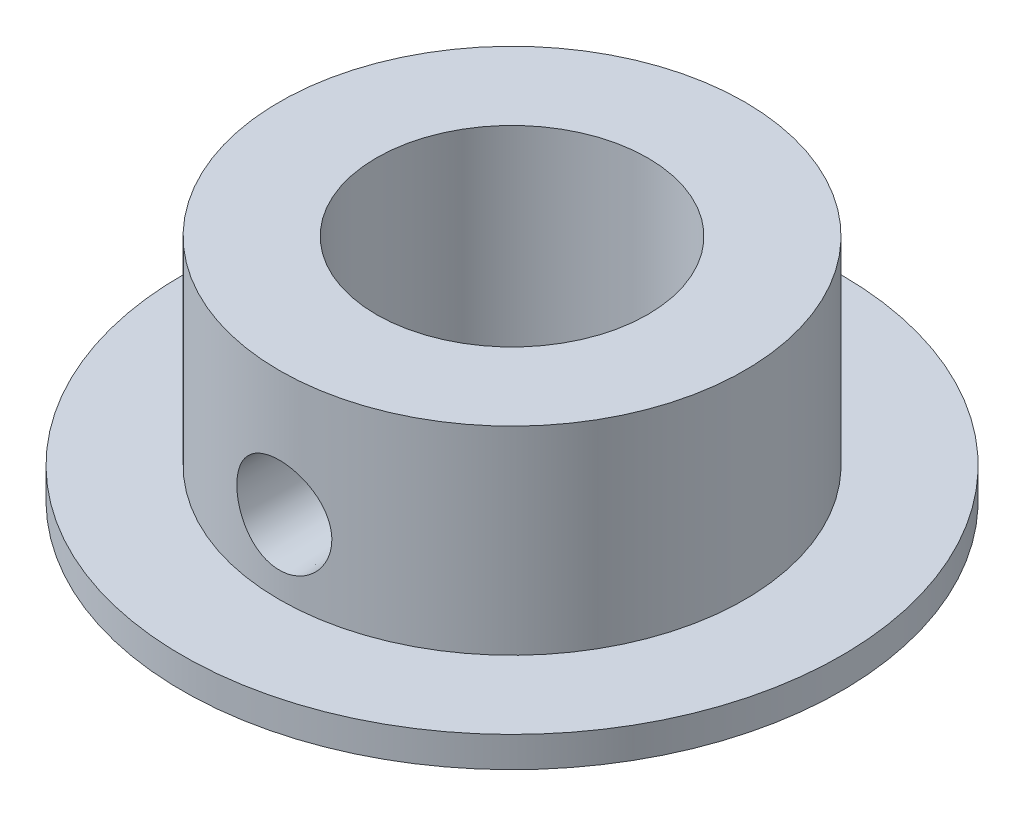
from build123d import *


# Read off the part's stored shape, not the designer's step: 1/4 NPT Tapped Hole1
with BuildPart() as part:
    # Sketch1 → Revolve1 (revolve)
    with BuildSketch(Plane.XY, mode=Mode.PRIVATE) as revolve1_sk:
        Polygon((-17.78, 0), (-17.78, 30), (-30.48, 30), (-30.48, 4), (-43.18, 4), (-43.18, 0), align=None)
    revolve(revolve1_sk.sketch.rotate(Axis((0, 0, 0), (0, 1, 0)), 270), axis=Axis((0, 0, 0), (0, 1, 0)))

    # 1/4 NPT Tapped Hole1 outline → 1/4 NPT Tapped Hole1 (revolve, cut)
    with BuildSketch(Plane.XZ.offset(-13.590721134)):
        Polygon((5.5626, 20.46), (5.943676082, 20.46), (6.243695498, 30.480240418), (0, 30.480240418), (0, 16.886929185), (5.5626, 16.886929185), align=None)
    revolve(axis=Axis((0, 13.590721134, 0), (0, 0, 1)), mode=Mode.SUBTRACT)


solid = part.part
